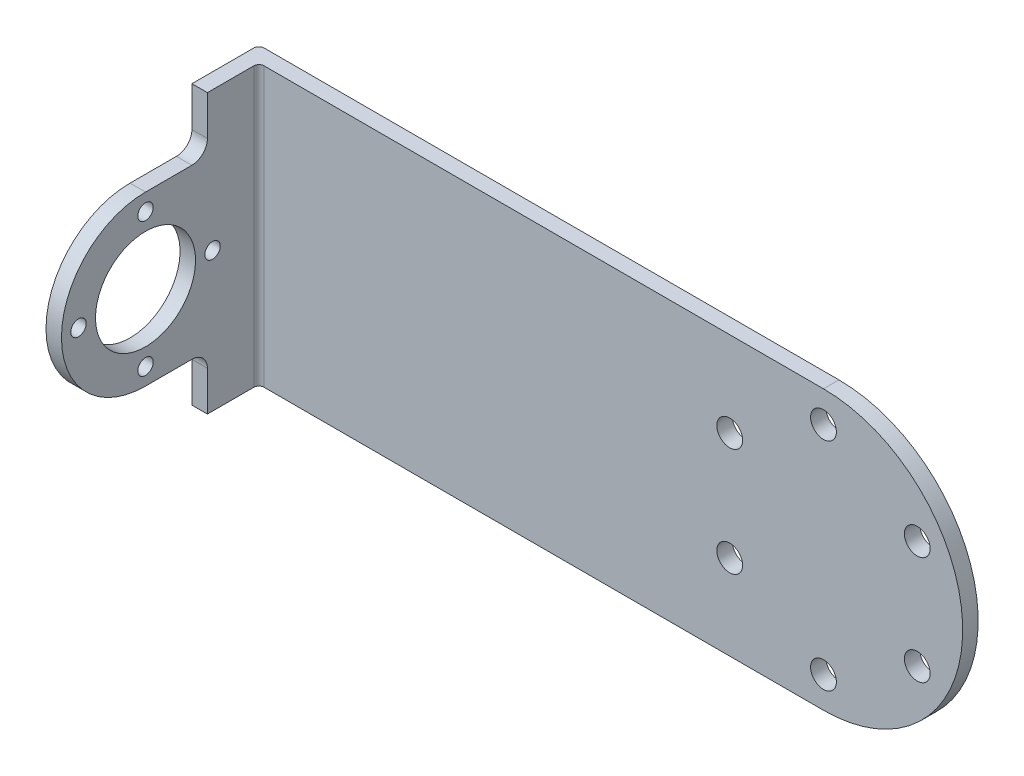
from build123d import *

# Parameters (mm, degrees)
SKETCH1_R           = 2.5
BOSS_EXTRUDE1_DEPTH = 3
SKETCH2_R           = 1.5
SKETCH2_R_2         = 9.7
BOSS_EXTRUDE2_DEPTH = 3
FILLET1_R           = 1


with BuildPart() as part:
    # Sketch1 → Boss-Extrude1 (new body)
    with BuildSketch(Plane.XY):
        with BuildLine():
            Line((0, 27), (-112.5, 27))
            Line((-112.5, 27), (-112.5, -27))
            Line((-112.5, -27), (0, -27))
            ThreePointArc((0, -27), (27, 0), (0, 27))
        make_face()
        with Locations((0, -21)):
            Circle(SKETCH1_R, mode=Mode.SUBTRACT)
        with Locations((-18.186533479, -10.5)):
            Circle(SKETCH1_R, mode=Mode.SUBTRACT)
        with Locations((18.186533479, -10.5)):
            Circle(SKETCH1_R, mode=Mode.SUBTRACT)
        with Locations((-18.186533479, 10.5)):
            Circle(SKETCH1_R, mode=Mode.SUBTRACT)
        with Locations((18.186533479, 10.5)):
            Circle(SKETCH1_R, mode=Mode.SUBTRACT)
        with Locations((0, 21)):
            Circle(SKETCH1_R, mode=Mode.SUBTRACT)
    extrude(amount=BOSS_EXTRUDE1_DEPTH)

    # Sketch2 → Boss-Extrude2 (add)
    with BuildSketch(Plane.ZY.offset(112.5)):
        with BuildLine():
            Line((3, 27), (3, -27))
            Line((3, -27), (13, -27))
            Line((13, -27), (13, -19.3))
            ThreePointArc((13, -19.3), (13.878679656, -17.178679656), (16, -16.3))
            Line((16, -16.3), (25, -16.3))
            ThreePointArc((25, -16.3), (41.3, 0), (25, 16.3))
            Line((25, 16.3), (16, 16.3))
            ThreePointArc((16, 16.3), (13.878679656, 17.178679656), (13, 19.3))
            Line((13, 19.3), (13, 27))
            Line((13, 27), (3, 27))
        make_face()
        with Locations((12, 0)):
            Circle(SKETCH2_R, mode=Mode.SUBTRACT)
        with Locations((25, -13)):
            Circle(SKETCH2_R, mode=Mode.SUBTRACT)
        with Locations((25, 0)):
            Circle(SKETCH2_R_2, mode=Mode.SUBTRACT)
        with Locations((25, 13)):
            Circle(SKETCH2_R, mode=Mode.SUBTRACT)
        with Locations((38, 0)):
            Circle(SKETCH2_R, mode=Mode.SUBTRACT)
    extrude(amount=-BOSS_EXTRUDE2_DEPTH)

    # Fillet1
    fillet1_edges = [part.edges().sort_by_distance(p)[0] for p in [
        (-109.5, 0, 3),
        (-112.5, 0, 0),
    ]]
    fillet(fillet1_edges, radius=FILLET1_R)


solid = part.part
